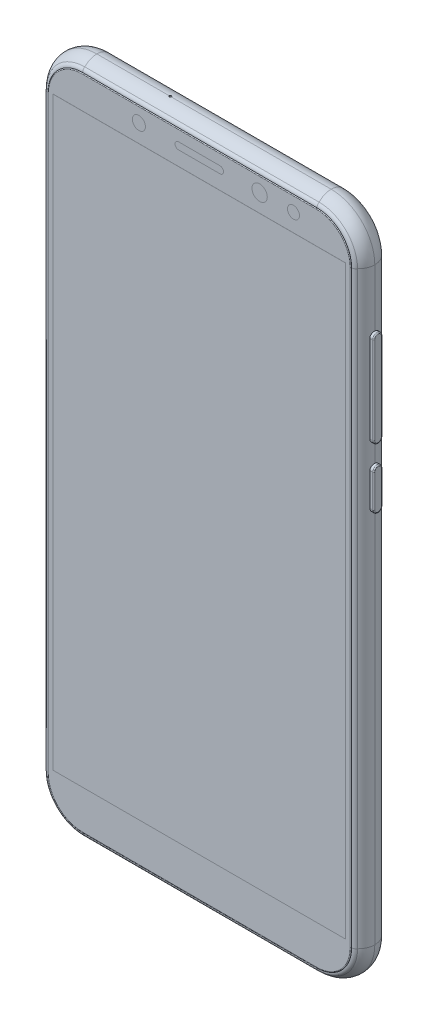
from build123d import *
from OCP.BRepFilletAPI import BRepFilletAPI_MakeChamfer

# Parameters (mm, degrees)
BOSS_EXTRUDE1_START       = -3.75
BOSS_EXTRUDE1_DEPTH       = 7.5
FILLET3_R                 = 3.75
FILLET4_R                 = 3.75
SKETCH7_W                 = 98.275097103
SKETCH7_H                 = 163.382348933
CUT_EXTRUDE3_DEPTH        = 1
BOSS_EXTRUDE4_DEPTH       = 0.5
FILLET6_R                 = 1
BOSS_EXTRUDE5_DEPTH       = 0.125
FILLET7_R                 = 0.25
CUT_EXTRUDE5_OUTLINE_R    = 1.375
CUT_EXTRUDE5_OUTLINE_R_2  = 1.75
CUT_EXTRUDE5_OUTLINE_R_3  = 1.5
CUT_EXTRUDE5_DEPTH        = 3.375
BOSS_EXTRUDE6_OUTLINE_R   = 1.375
BOSS_EXTRUDE6_OUTLINE_R_2 = 1.75
BOSS_EXTRUDE6_OUTLINE_R_3 = 1.5
BOSS_EXTRUDE6_DEPTH       = 3.375
BOSS_EXTRUDE7_DEPTH       = 3.375
SKETCH11_W                = 67.037317966
SKETCH11_H                = 134.07463593
CUT_EXTRUDE6_DEPTH        = 0.5
SKETCH11_2_W              = 67.037317966
SKETCH11_2_H              = 134.07463593
BOSS_EXTRUDE8_DEPTH       = 0.5
BOSS_EXTRUDE9_DEPTH       = 0.75
CHAMFER1_SIZE             = 0.375
SKETCH13_R                = 5.5
CUT_EXTRUDE7_DEPTH        = 0.5
CHAMFER2_SIZE             = 0.5
SKETCH14_R                = 1.5
CUT_EXTRUDE8_DEPTH        = 0.5
SKETCH14_3_R              = 1.5
BOSS_EXTRUDE10_DEPTH      = 0.5
SKETCH15_R                = 0.25
CUT_EXTRUDE9_DEPTH        = 1
SKETCH16_R                = 1.75
CUT_EXTRUDE11_DEPTH       = 15
CUT_EXTRUDE11_TAPER       = 1
SKETCH16_4_R              = 1
SKETCH16_4_R_2            = 0.5
CUT_EXTRUDE13_DEPTH       = 2
SKETCH17_W                = 13.25
SKETCH17_H                = 2
BOSS_EXTRUDE11_DEPTH      = 0.75
SKETCH18_W                = 67.087317966
SKETCH18_H                = 134.12463593
SKETCH18_W_2              = 67.037317966
SKETCH18_H_2              = 134.07463593
BOSS_EXTRUDE13_DEPTH      = 0.25
SKETCH20_R                = 1
BOSS_EXTRUDE15_DEPTH      = 0.3
CUT_EXTRUDE14_DEPTH       = 5
BOSS_EXTRUDE16_DEPTH      = 5.75
BOSS_EXTRUDE16_2_DEPTH    = 5.75
FILLET8_R                 = 0.25
FILLET9_R                 = 0.25
SKETCH26_R                = 2.5
SKETCH26_R_2              = 1.75
CUT_EXTRUDE16_DEPTH       = 0.75
SKETCH28_R                = 1.5
SKETCH28_R_2              = 0.875
CUT_EXTRUDE17_DEPTH       = 0.25
CHAMFER3_SIZE             = 0.5
CHAMFER3_SIZE_2           = 1.07225346
CHAMFER4_SIZE             = 0.3
CHAMFER4_SIZE_2           = 0.824243226
SKETCH26_2_R              = 2.5
SKETCH26_2_R_2            = 1.75
BOSS_EXTRUDE19_DEPTH      = 0.1
CHAMFER5_SIZE             = 0.3
CHAMFER5_SIZE2            = 0.824243226
CUT_EXTRUDE18_DEPTH       = 5
BOSS_EXTRUDE20_DEPTH      = 3
WRAP1_OUTLINE_W           = 0.664556962
WRAP1_OUTLINE_H           = 2.5
WRAP1_DEPTH               = 0.01


# Read off the part's stored shape, not the designer's step: Boss-Extrude1, Cut-Extrude5, Boss-Extrude6, Boss-Extrude7, Wrap1
# Some blends are built 0.0001 mm under size
with BuildPart() as part:
    # Boss-Extrude1 outline → Boss-Extrude1 (new body)
    with BuildSketch(Plane.XY.offset(BOSS_EXTRUDE1_START)):
        with BuildLine():
            ThreePointArc((36.825, 66.65), (33.896067812, 73.721067812), (26.825, 76.65))
            Line((26.825, 76.65), (-26.825, 76.65))
            ThreePointArc((-26.825, 76.65), (-33.896067812, 73.721067812), (-36.825, 66.65))
            Line((-36.825, 66.65), (-36.825, -68.2))
            ThreePointArc((-36.825, -68.2), (-33.896067812, -75.271067812), (-26.825, -78.2))
            Line((-26.825, -78.2), (26.825, -78.2))
            ThreePointArc((26.825, -78.2), (33.896067812, -75.271067812), (36.825, -68.2))
            Line((36.825, -68.2), (36.825, 66.65))
        make_face()
    extrude(amount=BOSS_EXTRUDE1_DEPTH)

    # Fillet3
    fillet3_edges = [part.edges().sort_by_distance(p)[0] for p in [
        (33.896067812, -75.271067812, -3.75),
        (36.825, -0.775, -3.75),
        (33.896067812, 73.721067812, -3.75),
        (0, 76.65, -3.75),
        (-33.896067812, 73.721067812, -3.75),
        (-36.825, -0.775, -3.75),
        (-33.896067812, -75.271067812, -3.75),
        (0, -78.2, -3.75),
    ]]
    fillet(fillet3_edges, radius=FILLET3_R)

    # Fillet4
    fillet4_edges = [part.edges().sort_by_distance(p)[0] for p in [
        (33.896067812, 73.721067812, 3.75),
        (36.825, -0.775, 3.75),
        (33.896067812, -75.271067812, 3.75),
        (0, -78.2, 3.75),
        (-33.896067812, -75.271067812, 3.75),
        (-36.825, -0.775, 3.75),
        (-33.896067812, 73.721067812, 3.75),
        (0, 76.65, 3.75),
    ]]
    fillet(fillet4_edges, radius=FILLET4_R - 0.0001)  # a hair under: the kernel refuses the full size

    # Sketch7 → Cut-Extrude3 (cut)
    with BuildSketch(Plane.XY.offset(3.75)):
        with Locations((-0.573991347, -2.324377783)):
            Rectangle(SKETCH7_W, SKETCH7_H)
    extrude(amount=-CUT_EXTRUDE3_DEPTH, mode=Mode.SUBTRACT)


with BuildPart() as body_2:
    # Sketch8 → Boss-Extrude4 (new body)
    with BuildSketch(Plane.XY.offset(2.75)):
        with BuildLine():
            Line((-26.825, -76.999509757), (26.825, -76.999509757))
            ThreePointArc((26.825, -76.999509757), (33.04719302, -74.42219302), (35.624509757, -68.2))
            Line((35.624509757, -68.2), (35.624509757, 66.65))
            ThreePointArc((35.624509757, 66.65), (33.04719302, 72.87219302), (26.825, 75.449509757))
            Line((26.825, 75.449509757), (-26.825, 75.449509757))
            ThreePointArc((-26.825, 75.449509757), (-33.04719302, 72.87219302), (-35.624509757, 66.65))
            Line((-35.624509757, 66.65), (-35.624509757, -68.2))
            ThreePointArc((-35.624509757, -68.2), (-33.04719302, -74.42219302), (-26.825, -76.999509757))
        make_face()
    extrude(amount=BOSS_EXTRUDE4_DEPTH)

    # Fillet6
    # the kernel refuses this fillet: 1 mm, written as the material it takes off along each edge
    with BuildSketch(Plane(origin=(-35.624509757, 66.65, 3.25), x_dir=(0, 0, -1), z_dir=(0, -1, 0)), Plane(origin=(35.624509757, -68.2, 3.25), x_dir=(0, 0, -1), z_dir=(0, 1, 0))) as fillet6_piece_1:
        with BuildLine():
            CenterArc((1, 0.866025404), FILLET6_R, 180, 60)
            Line((0, 0.866025404), (-0.02, 0.866025404))
            Line((-0.02, 0.866025404), (-0.02, 0))
            Line((-0.02, 0), (0, -0.02))
            ThreePointArc((0, -0.02), (0.25, -0.02), (0.49, -0.017320508))
            Line((0.49, -0.017320508), (0.5, 0))
        make_face()
    extrude(amount=134.85, mode=Mode.SUBTRACT)
    with BuildSketch(Plane(origin=(-26.825, 66.65, 3.25), x_dir=(0, 1, 0), z_dir=(1, 0, 0))) as fillet6_piece_2:
        with BuildLine():
            CenterArc((7.933484353, -1), FILLET6_R, 30, 60)
            Line((7.933484353, 0), (7.933484353, 0.02))
            Line((7.933484353, 0.02), (8.799509757, 0.02))
            Line((8.799509757, 0.02), (8.819509757, 0))
            ThreePointArc((8.819509757, 0), (8.819509757, -0.25), (8.816830265, -0.49))
            Line((8.816830265, -0.49), (8.799509757, -0.5))
        make_face()
    revolve(axis=Axis((-26.825, 66.65, 3.25), (0, 0, 1)), revolution_arc=90, mode=Mode.SUBTRACT)
    with BuildSketch(Plane(origin=(26.825, 75.449509757, 3.25), x_dir=(0, 0, -1), z_dir=(-1, 0, 0)), Plane(origin=(-26.825, -76.999509757, 3.25), x_dir=(0, 0, -1), z_dir=(1, 0, 0))) as fillet6_piece_3:
        with BuildLine():
            CenterArc((1, 0.866025404), FILLET6_R, 180, 60)
            Line((0, 0.866025404), (-0.02, 0.866025404))
            Line((-0.02, 0.866025404), (-0.02, 0))
            Line((-0.02, 0), (0, -0.02))
            ThreePointArc((0, -0.02), (0.25, -0.02), (0.49, -0.017320508))
            Line((0.49, -0.017320508), (0.5, 0))
        make_face()
    extrude(amount=53.65, mode=Mode.SUBTRACT)
    with BuildSketch(Plane(origin=(26.825, 66.65, 3.25), x_dir=(1, 0, 0), z_dir=(0, -1, 0))) as fillet6_piece_4:
        with BuildLine():
            CenterArc((7.933484353, -1), FILLET6_R, 30, 60)
            Line((7.933484353, 0), (7.933484353, 0.02))
            Line((7.933484353, 0.02), (8.799509757, 0.02))
            Line((8.799509757, 0.02), (8.819509757, 0))
            ThreePointArc((8.819509757, 0), (8.819509757, -0.25), (8.816830265, -0.49))
            Line((8.816830265, -0.49), (8.799509757, -0.5))
        make_face()
    revolve(axis=Axis((26.825, 66.65, 3.25), (0, 0, 1)), revolution_arc=90, mode=Mode.SUBTRACT)
    with BuildSketch(Plane(origin=(26.825, -68.2, 3.25), x_dir=(0, -1, 0), z_dir=(-1, 0, 0))) as fillet6_piece_5:
        with BuildLine():
            CenterArc((7.933484353, -1), FILLET6_R, 30, 60)
            Line((7.933484353, 0), (7.933484353, 0.02))
            Line((7.933484353, 0.02), (8.799509757, 0.02))
            Line((8.799509757, 0.02), (8.819509757, 0))
            ThreePointArc((8.819509757, 0), (8.819509757, -0.25), (8.816830265, -0.49))
            Line((8.816830265, -0.49), (8.799509757, -0.5))
        make_face()
    revolve(axis=Axis((26.825, -68.2, 3.25), (0, 0, 1)), revolution_arc=90, mode=Mode.SUBTRACT)
    with BuildSketch(Plane(origin=(-26.825, -68.2, 3.25), x_dir=(-1, 0, 0), z_dir=(0, 1, 0))) as fillet6_piece_6:
        with BuildLine():
            CenterArc((7.933484353, -1), FILLET6_R, 30, 60)
            Line((7.933484353, 0), (7.933484353, 0.02))
            Line((7.933484353, 0.02), (8.799509757, 0.02))
            Line((8.799509757, 0.02), (8.819509757, 0))
            ThreePointArc((8.819509757, 0), (8.819509757, -0.25), (8.816830265, -0.49))
            Line((8.816830265, -0.49), (8.799509757, -0.5))
        make_face()
    revolve(axis=Axis((-26.825, -68.2, 3.25), (0, 0, 1)), revolution_arc=90, mode=Mode.SUBTRACT)


with BuildPart() as body_3:
    # Sketch9 → Boss-Extrude5 (new body)
    with BuildSketch(Plane.XY.offset(3.25)):
        with BuildLine():
            Line((-34.758484353, 66.65), (-34.758484353, -68.2))
            ThreePointArc((-34.758484353, -68.2), (-32.434820584, -73.809820584), (-26.825, -76.133484353))
            Line((-26.825, -76.133484353), (26.825, -76.133484353))
            ThreePointArc((26.825, -76.133484353), (32.434820584, -73.809820584), (34.758484353, -68.2))
            Line((34.758484353, -68.2), (34.758484353, 66.65))
            ThreePointArc((34.758484353, 66.65), (32.434820584, 72.259820584), (26.825, 74.583484353))
            Line((26.825, 74.583484353), (-26.825, 74.583484353))
            ThreePointArc((-26.825, 74.583484353), (-32.434820584, 72.259820584), (-34.758484353, 66.65))
        make_face()
    extrude(amount=BOSS_EXTRUDE5_DEPTH)

    # Fillet7
    # the kernel refuses this fillet: 0.25 mm, written as the material it takes off along each edge
    with BuildSketch(Plane(origin=(26.825, 74.583484353, 3.375), x_dir=(0, 0, -1), z_dir=(-1, 0, 0)), Plane(origin=(-26.825, -76.133484353, 3.375), x_dir=(0, 0, -1), z_dir=(1, 0, 0))) as fillet7_piece_1:
        with BuildLine():
            CenterArc((0.25, 0.216506351), FILLET7_R, 180, 60)
            Line((0, 0.216506351), (-0.005, 0.216506351))
            Line((-0.005, 0.216506351), (-0.005, 0))
            Line((-0.005, 0), (0, -0.005))
            ThreePointArc((0, -0.005), (0.0625, -0.005), (0.1225, -0.004330127))
            Line((0.1225, -0.004330127), (0.125, 0))
        make_face()
    extrude(amount=53.65, mode=Mode.SUBTRACT)
    with BuildSketch(Plane(origin=(26.825, 66.65, 3.375), x_dir=(1, 0, 0), z_dir=(0, -1, 0))) as fillet7_piece_2:
        with BuildLine():
            CenterArc((7.716978002, -0.25), FILLET7_R, 30, 60)
            Line((7.716978002, 0), (7.716978002, 0.005))
            Line((7.716978002, 0.005), (7.933484353, 0.005))
            Line((7.933484353, 0.005), (7.938484353, 0))
            ThreePointArc((7.938484353, 0), (7.938484353, -0.0625), (7.93781448, -0.1225))
            Line((7.93781448, -0.1225), (7.933484353, -0.125))
        make_face()
    revolve(axis=Axis((26.825, 66.65, 3.375), (0, 0, 1)), revolution_arc=90, mode=Mode.SUBTRACT)
    with BuildSketch(Plane(origin=(34.758484353, -68.2, 3.375), x_dir=(0, 0, -1), z_dir=(0, 1, 0)), Plane(origin=(-34.758484353, 66.65, 3.375), x_dir=(0, 0, -1), z_dir=(0, -1, 0))) as fillet7_piece_3:
        with BuildLine():
            CenterArc((0.25, 0.216506351), FILLET7_R, 180, 60)
            Line((0, 0.216506351), (-0.005, 0.216506351))
            Line((-0.005, 0.216506351), (-0.005, 0))
            Line((-0.005, 0), (0, -0.005))
            ThreePointArc((0, -0.005), (0.0625, -0.005), (0.1225, -0.004330127))
            Line((0.1225, -0.004330127), (0.125, 0))
        make_face()
    extrude(amount=134.85, mode=Mode.SUBTRACT)
    with BuildSketch(Plane(origin=(26.825, -68.2, 3.375), x_dir=(0, -1, 0), z_dir=(-1, 0, 0))) as fillet7_piece_4:
        with BuildLine():
            CenterArc((7.716978002, -0.25), FILLET7_R, 30, 60)
            Line((7.716978002, 0), (7.716978002, 0.005))
            Line((7.716978002, 0.005), (7.933484353, 0.005))
            Line((7.933484353, 0.005), (7.938484353, 0))
            ThreePointArc((7.938484353, 0), (7.938484353, -0.0625), (7.93781448, -0.1225))
            Line((7.93781448, -0.1225), (7.933484353, -0.125))
        make_face()
    revolve(axis=Axis((26.825, -68.2, 3.375), (0, 0, 1)), revolution_arc=90, mode=Mode.SUBTRACT)
    with BuildSketch(Plane(origin=(-26.825, -68.2, 3.375), x_dir=(-1, 0, 0), z_dir=(0, 1, 0))) as fillet7_piece_5:
        with BuildLine():
            CenterArc((7.716978002, -0.25), FILLET7_R, 30, 60)
            Line((7.716978002, 0), (7.716978002, 0.005))
            Line((7.716978002, 0.005), (7.933484353, 0.005))
            Line((7.933484353, 0.005), (7.938484353, 0))
            ThreePointArc((7.938484353, 0), (7.938484353, -0.0625), (7.93781448, -0.1225))
            Line((7.93781448, -0.1225), (7.933484353, -0.125))
        make_face()
    revolve(axis=Axis((-26.825, -68.2, 3.375), (0, 0, 1)), revolution_arc=90, mode=Mode.SUBTRACT)
    with BuildSketch(Plane(origin=(-26.825, 66.65, 3.375), x_dir=(0, 1, 0), z_dir=(1, 0, 0))) as fillet7_piece_6:
        with BuildLine():
            CenterArc((7.716978002, -0.25), FILLET7_R, 30, 60)
            Line((7.716978002, 0), (7.716978002, 0.005))
            Line((7.716978002, 0.005), (7.933484353, 0.005))
            Line((7.933484353, 0.005), (7.938484353, 0))
            ThreePointArc((7.938484353, 0), (7.938484353, -0.0625), (7.93781448, -0.1225))
            Line((7.93781448, -0.1225), (7.933484353, -0.125))
        make_face()
    revolve(axis=Axis((-26.825, 66.65, 3.375), (0, 0, 1)), revolution_arc=90, mode=Mode.SUBTRACT)


with BuildPart() as cut_extrude5_tool:
    # Cut-Extrude5 outline → Cut-Extrude5 (new body)
    with BuildSketch(Plane.XY):
        with Locations((21.575, 71.15)):
            Circle(CUT_EXTRUDE5_OUTLINE_R)
        with Locations((13.825, 71.15)):
            Circle(CUT_EXTRUDE5_OUTLINE_R_2)
        with BuildLine():
            ThreePointArc((4.75, 70.35), (5.55, 71.15), (4.75, 71.95))
            Line((4.75, 71.95), (-4.75, 71.95))
            ThreePointArc((-4.75, 71.95), (-5.55, 71.15), (-4.75, 70.35))
            Line((-4.75, 70.35), (4.75, 70.35))
        make_face()
        with Locations((-13.825, 71.15)):
            Circle(CUT_EXTRUDE5_OUTLINE_R_3)
    extrude(amount=CUT_EXTRUDE5_DEPTH)


with BuildPart() as part_1:
    add(part.part)

    # Cut-Extrude5: cut by cut_extrude5_tool
    add(cut_extrude5_tool.part, mode=Mode.SUBTRACT)

    # Sketch13 → Cut-Extrude7 (cut)
    with BuildSketch(Plane(origin=(0, 0, -3.75), x_dir=(-1, 0, 0), z_dir=(0, 0, -1))):
        with Locations((0, 39.25)):
            Circle(SKETCH13_R)
    extrude(amount=-CUT_EXTRUDE7_DEPTH, mode=Mode.SUBTRACT)

    # Chamfer2
    chamfer2_edges = [part_1.edges().sort_by_distance(p)[0] for p in [
        (5.5, 39.25, -3.25),
    ]]
    chamfer(chamfer2_edges, length=CHAMFER2_SIZE - 0.0001)  # a hair under: the kernel refuses the full size

    # Sketch14 → Cut-Extrude8 (cut)
    with BuildSketch(Plane(origin=(0, 0, -3.75), x_dir=(-1, 0, 0), z_dir=(0, 0, -1))):
        with Locations((0, 69.75)):
            Circle(SKETCH14_R)
    extrude(amount=-CUT_EXTRUDE8_DEPTH, mode=Mode.SUBTRACT)

    # Sketch15 → Cut-Extrude9 (cut)
    with BuildSketch(Plane(origin=(0, 76.65, 0), x_dir=(1, 0, 0), z_dir=(0, 1, 0))):
        with Locations(Location((-10, 0, 0), (0, 0, 270))):
            Circle(SKETCH15_R)
    extrude(amount=-CUT_EXTRUDE9_DEPTH, mode=Mode.SUBTRACT)

    # Sketch16 → Cut-Extrude11 (cut)
    with BuildSketch(Plane(origin=(0, -78.2, 0), x_dir=(1, 0, 0), z_dir=(0, 1, 0))):
        with Locations((-23.5, 1.5)):
            Circle(SKETCH16_R)
    extrude(amount=CUT_EXTRUDE11_DEPTH, taper=CUT_EXTRUDE11_TAPER, mode=Mode.SUBTRACT)

    # Sketch16<4> → Cut-Extrude13 (cut)
    with BuildSketch(Plane(origin=(0, -78.2, 0), x_dir=(1, 0, 0), z_dir=(0, 1, 0))):
        with Locations(Location((13.75, 1, 0), (0, 0, 270))):
            Circle(SKETCH16_4_R)
        with Locations(Location((16, 1, 0), (0, 0, 270))):
            Circle(SKETCH16_4_R)
        with Locations(Location((18.25, 1, 0), (0, 0, 270))):
            Circle(SKETCH16_4_R)
        with Locations(Location((20.5, 1, 0), (0, 0, 270))):
            Circle(SKETCH16_4_R)
        with Locations(Location((22.75, 1, 0), (0, 0, 270))):
            Circle(SKETCH16_4_R)
        with Locations(Location((25, 1, 0), (0, 0, 270))):
            Circle(SKETCH16_4_R)
        with Locations(Location((-16, 0.25, 0), (0, 0, 330))):
            Circle(SKETCH16_4_R_2)
    extrude(amount=CUT_EXTRUDE13_DEPTH, mode=Mode.SUBTRACT)

    # Sketch21 → Cut-Extrude14 (cut)
    with BuildSketch(Plane(origin=(36.825, 0, 0), x_dir=(0, 0, -1), z_dir=(1, 0, 0))):
        with BuildLine():
            Line((1, 52.525), (1, 32.525))
            ThreePointArc((1, 32.525), (0, 31.525), (-1, 32.525))
            Line((-1, 32.525), (-1, 52.525))
            ThreePointArc((-1, 52.525), (0, 53.525), (1, 52.525))
        make_face()
        with BuildLine():
            Line((1, 26.275), (1, 18.775))
            ThreePointArc((1, 18.775), (0, 17.775), (-1, 18.775))
            Line((-1, 18.775), (-1, 26.275))
            ThreePointArc((-1, 26.275), (0, 27.275), (1, 26.275))
        make_face()
    extrude(amount=-CUT_EXTRUDE14_DEPTH, mode=Mode.SUBTRACT)

    # Sketch28 → Cut-Extrude17 (cut)
    with BuildSketch(Plane(origin=(0, 0, -3.75), x_dir=(-1, 0, 0), z_dir=(0, 0, -1))):
        with Locations((0, 61.275)):
            Circle(SKETCH28_R)
        with Locations((0, 52.525)):
            Circle(SKETCH28_R_2)
    extrude(amount=-CUT_EXTRUDE17_DEPTH, mode=Mode.SUBTRACT)

    # Chamfer3
    # the kernel refuses this chamfer: 1.07225346, 0.5 mm, written as the material it adds along each edge
    with BuildSketch(Plane(origin=(0, 61.275, -3.5), x_dir=(-1, 0, 0), z_dir=(0, -1, 0))) as chamfer3_piece_1_section:
        Polygon((1.5, CHAMFER3_SIZE), (1.5 - CHAMFER3_SIZE_2, 0), (1.5, 0), align=None)
    chamfer3_piece_1 = revolve(axis=Axis((0, 61.275, -3.5), (0, 0, -1)), mode=Mode.PRIVATE)
    chamfer3_piece_1 = split(chamfer3_piece_1, bisect_by=Plane(origin=(0.681277572, 61.275, -3.75), z_dir=(0, 0, 1)), keep=Keep.TOP, mode=Mode.PRIVATE)
    add(chamfer3_piece_1)

    # Chamfer4
    # the kernel refuses this chamfer: 0.824243226, 0.3 mm, written as the material it adds along each edge
    with BuildSketch(Plane(origin=(0, 52.525, -3.5), x_dir=(-1, 0, 0), z_dir=(0, -1, 0))) as chamfer4_piece_1_section:
        Polygon((0.875, CHAMFER4_SIZE), (0.875 - CHAMFER4_SIZE_2, 0), (0.875, 0), align=None)
    chamfer4_piece_1 = revolve(axis=Axis((0, 52.525, -3.5), (0, 0, -1)), mode=Mode.PRIVATE)
    chamfer4_piece_1 = split(chamfer4_piece_1, bisect_by=Plane(origin=(0.381438827, 52.525, -3.75), z_dir=(0, 0, 1)), keep=Keep.TOP, mode=Mode.PRIVATE)
    add(chamfer4_piece_1)

    # Sketch29 → Cut-Extrude18 (cut)
    with BuildSketch(Plane(origin=(0, -78.2, 0), x_dir=(1, 0, 0), z_dir=(0, 1, 0))):
        with BuildLine():
            Line((-3, 1.75), (3, 1.75))
            Line((3, 1.75), (4, 1.83816349))
            Line((4, 1.83816349), (4.5, 1.75))
            Line((4.5, 1.75), (4.5, 0.374264069))
            ThreePointArc((4.5, 0.374264069), (4.47716386, 0.259459039), (4.412132034, 0.162132034))
            Line((4.412132034, 0.162132034), (4.087867966, -0.162132034))
            ThreePointArc((4.087867966, -0.162132034), (3.990540961, -0.22716386), (3.875735931, -0.25))
            Line((3.875735931, -0.25), (-3.875735931, -0.25))
            ThreePointArc((-3.875735931, -0.25), (-3.990540961, -0.22716386), (-4.087867966, -0.162132034))
            Line((-4.087867966, -0.162132034), (-4.412132034, 0.162132034))
            ThreePointArc((-4.412132034, 0.162132034), (-4.47716386, 0.259459039), (-4.5, 0.374264069))
            Line((-4.5, 0.374264069), (-4.5, 1.75))
            Line((-4.5, 1.75), (-4, 1.83816349))
            Line((-4, 1.83816349), (-3, 1.75))
        make_face()
    extrude(amount=CUT_EXTRUDE18_DEPTH, mode=Mode.SUBTRACT)

    # Sketch30 → Boss-Extrude20 (add)
    with BuildSketch(Plane.XZ.offset(73.2)):
        Polygon((1.25, -1.4), (1.75, -1.4), (1.75, -1.35), (2.75, -1.35), (2.75, -1.4), (2.75, -1.55), (-2.75, -1.55), (-2.75, -1.4), (-2.75, -1.35), (-1.75, -1.35), (-1.75, -1.4), (-1.25, -1.4), (-1.25, -1.35), (-0.25, -1.35), (-0.25, -1.4), (0.25, -1.4), (0.25, -1.35), (1.25, -1.35), align=None)
    extrude(amount=BOSS_EXTRUDE20_DEPTH)


with BuildPart() as body_2_1:
    add(body_2.part)

    # Cut-Extrude5: cut by cut_extrude5_tool
    add(cut_extrude5_tool.part, mode=Mode.SUBTRACT)


with BuildPart() as body_3_1:
    add(body_3.part)

    # Cut-Extrude5: cut by cut_extrude5_tool
    add(cut_extrude5_tool.part, mode=Mode.SUBTRACT)


with BuildPart() as body_4:
    # Boss-Extrude6 outline → Boss-Extrude6 (new body)
    with BuildSketch(Plane.XY):
        with Locations((21.575, 71.15)):
            Circle(BOSS_EXTRUDE6_OUTLINE_R)
        with Locations((13.825, 71.15)):
            Circle(BOSS_EXTRUDE6_OUTLINE_R_2)
        with Locations((-13.825, 71.15)):
            Circle(BOSS_EXTRUDE6_OUTLINE_R_3)
    extrude(amount=BOSS_EXTRUDE6_DEPTH)


with BuildPart() as body_5:
    # Boss-Extrude7 outline → Boss-Extrude7 (new body)
    with BuildSketch(Plane.XY):
        with BuildLine():
            Line((-4.75, 70.35), (4.75, 70.35))
            ThreePointArc((4.75, 70.35), (5.55, 71.15), (4.75, 71.95))
            Line((4.75, 71.95), (-4.75, 71.95))
            ThreePointArc((-4.75, 71.95), (-5.55, 71.15), (-4.75, 70.35))
        make_face()
    extrude(amount=BOSS_EXTRUDE7_DEPTH)


with BuildPart() as cut_extrude6_tool:
    # Sketch11 → Cut-Extrude6 (new body)
    with BuildSketch(Plane.XY.offset(3.375)):
        Rectangle(SKETCH11_W, SKETCH11_H)
    extrude(amount=-CUT_EXTRUDE6_DEPTH)


with BuildPart() as body_2_2:
    add(body_2_1.part)

    # Cut-Extrude6: cut by cut_extrude6_tool
    add(cut_extrude6_tool.part, mode=Mode.SUBTRACT)

    # Wrap1 outline → Wrap1 (add)
    # profile 1 of 6: a face of its own
    with BuildSketch(Plane.XY.offset(3.25)):
        with BuildLine():
            add(Edge.make_bspline(
                [(-4.272151899, -72.605497802), (-4.272103151, -72.629901637), (-4.272009862, -72.676602742), (-4.267466785, -72.743173199), (-4.262816767, -72.803370143), (-4.254087951, -72.856600114), (-4.244459561, -72.903524471), (-4.23064322, -72.943127736), (-4.216536835, -72.976985589), (-4.198120437, -73.004290978), (-4.175699439, -73.026387544), (-4.149116235, -73.045451421), (-4.117230762, -73.060928411), (-4.080743792, -73.07382795), (-4.039453801, -73.08357735), (-3.993278043, -73.090170191), (-3.942273322, -73.094800417), (-3.906591215, -73.095266329), (-3.887954905, -73.095509669)],
                knots=[0, 0, 0, 0, 0.098463136, 0.188426829, 0.269251677, 0.341981202, 0.406054352, 0.462222047, 0.511056507, 0.553678021, 0.594131488, 0.637514529, 0.685114564, 0.73666458, 0.793459079, 0.856022604, 0.924802442, 1, 1, 1, 1], degree=3))
            Line((-4.272151899, -72.605497802), (-4.272151899, -71.133484353))
            Line((-4.272151899, -71.133484353), (-4.936708861, -71.133484353))
            Line((-4.936708861, -71.133484353), (-4.936708861, -72.657910777))
            add(Edge.make_bspline(
                [(-4.751285601, -73.414932138), (-4.767301136, -73.395196677), (-4.799545495, -73.355462923), (-4.838553785, -73.288773383), (-4.871281602, -73.217340974), (-4.891774528, -73.153228228), (-4.904715486, -73.097365713), (-4.913762015, -73.050082324), (-4.920287166, -72.997355537), (-4.926231996, -72.939492391), (-4.931201751, -72.87635647), (-4.934554961, -72.808093716), (-4.936563604, -72.734729643), (-4.936659304, -72.684118631), (-4.936708861, -72.657910777)],
                knots=[0, 0, 0, 0, 0.095471978, 0.192215427, 0.289588384, 0.390547671, 0.444677731, 0.50522475, 0.571504321, 0.644412587, 0.724001007, 0.809656588, 0.901434644, 1, 1, 1, 1], degree=3))
            add(Edge.make_bspline(
                [(-3.990803006, -73.665129923), (-4.014868385, -73.664901523), (-4.06185799, -73.664455554), (-4.130463312, -73.66211289), (-4.195276506, -73.657690253), (-4.256162338, -73.651403756), (-4.313176919, -73.642807485), (-4.366566969, -73.633264218), (-4.416000368, -73.62123429), (-4.476318652, -73.604014477), (-4.545613018, -73.574961102), (-4.62258891, -73.532193823), (-4.691876497, -73.478707626), (-4.731401586, -73.436277566), (-4.751285601, -73.414932138)],
                knots=[0, 0, 0, 0, 0.087182691, 0.17023128, 0.248633885, 0.32248448, 0.391895532, 0.457477181, 0.518881284, 0.57612994, 0.68457129, 0.790181218, 0.894445786, 1, 1, 1, 1], degree=3))
            Line((-3.990803006, -73.665129923), (-3.66445807, -73.665129923))
            add(Edge.make_bspline(
                [(-2.901997627, -73.414932138), (-2.92202898, -73.436305935), (-2.961947456, -73.478899632), (-3.032152415, -73.532043643), (-3.109637268, -73.57500343), (-3.179303117, -73.603939204), (-3.239751378, -73.621247082), (-3.289036901, -73.633196479), (-3.342237361, -73.642868976), (-3.399100813, -73.651392768), (-3.459983962, -73.657693474), (-3.524797942, -73.662111953), (-3.593403038, -73.664455808), (-3.640392675, -73.664901609), (-3.66445807, -73.665129923)],
                knots=[0, 0, 0, 0, 0.105778007, 0.210794381, 0.316728416, 0.425520862, 0.482663705, 0.543954313, 0.608828818, 0.678111576, 0.751825671, 0.830083362, 0.912978451, 1, 1, 1, 1], degree=3))
            add(Edge.make_bspline(
                [(-2.721518987, -72.657910777), (-2.721571896, -72.684612942), (-2.721674136, -72.73621242), (-2.72363723, -72.810896508), (-2.727098107, -72.879967346), (-2.731647479, -72.943587535), (-2.736550005, -73.001730938), (-2.74431019, -73.054429557), (-2.752427507, -73.10165428), (-2.76478619, -73.156848061), (-2.784713514, -73.220006148), (-2.81591771, -73.290547421), (-2.85450392, -73.356215561), (-2.886161289, -73.395353638), (-2.901997627, -73.414932138)],
                knots=[0, 0, 0, 0, 0.100588621, 0.194378255, 0.281413628, 0.361085759, 0.434670275, 0.501141981, 0.561676296, 0.615149931, 0.71412158, 0.810578019, 0.905243216, 1, 1, 1, 1], degree=3))
            Line((-2.721518987, -72.657910777), (-2.721518987, -71.133484353))
            Line((-2.721518987, -71.133484353), (-3.386075949, -71.133484353))
            Line((-3.386075949, -71.133484353), (-3.386075949, -72.605497802))
            add(Edge.make_bspline(
                [(-3.766811709, -73.095509669), (-3.748345654, -73.095197005), (-3.712852383, -73.094596038), (-3.662118898, -73.090849783), (-3.616292102, -73.084057264), (-3.57537131, -73.074233413), (-3.539333107, -73.061603113), (-3.507984328, -73.046156124), (-3.4815996, -73.028044101), (-3.4595718, -73.00626468), (-3.44175034, -72.979103818), (-3.426812299, -72.945843061), (-3.413938412, -72.905707309), (-3.404091086, -72.858759343), (-3.395576288, -72.80514864), (-3.389915506, -72.744709074), (-3.386455802, -72.677401296), (-3.386206582, -72.630225719), (-3.386075949, -72.605497802)],
                knots=[0, 0, 0, 0, 0.074708996, 0.143596808, 0.205649136, 0.261930043, 0.313602087, 0.359823778, 0.402924381, 0.442530604, 0.484327126, 0.533553448, 0.589644431, 0.654520179, 0.727421869, 0.80916471, 0.899970294, 1, 1, 1, 1], degree=3))
            Line((-3.766811709, -73.095509669), (-3.887954905, -73.095509669))
        make_face()
    # profile 2 of 6: a face of its own
    with BuildSketch(Plane.XY.offset(3.25)):
        Polygon((-6.307357595, -72.09719084), (-6.749901108, -71.133484353), (-7.5, -71.133484353), (-6.64556962, -72.757297644), (-6.64556962, -73.633484353), (-5.981012658, -73.633484353), (-5.981012658, -72.757297644), (-5.126582278, -71.133484353), (-5.873714399, -71.133484353), align=None)
    # profile 3 of 6: a face of its own
    with BuildSketch(Plane.XY.offset(3.25)):
        Polygon((-0.697685918, -71.133484353), (-1.722211234, -71.133484353), (-2.436708861, -73.633484353), (-1.722211234, -73.633484353), (-1.60897943, -73.190446378), (-0.826246044, -73.190446378), (-0.714497627, -73.633484353), (0, -73.633484353), align=None)
        Polygon((-1.190170095, -71.650691631), (-0.942939082, -72.684117264), (-1.48684731, -72.684117264), (-1.233188291, -71.650691631), align=None, mode=Mode.SUBTRACT)
    # profile 4 of 6: a face of its own
    with BuildSketch(Plane.XY.offset(3.25)):
        Polygon((2.196400316, -71.133484353), (1.45272943, -71.133484353), (1.065565665, -73.049030239), (0.830696203, -71.133484353), (0.158227848, -71.133484353), (0.540446994, -73.633484353), (1.499208861, -73.633484353), (1.814675633, -71.937479606), (2.118275316, -73.633484353), (3.067147943, -73.633484353), (3.481012658, -71.133484353), (2.812005538, -71.133484353), (2.551918513, -73.049030239), align=None)
    # profile 5 of 6: a face of its own
    with BuildSketch(Plane.XY.offset(3.25)):
        Polygon((5.732792722, -71.133484353), (3.860759494, -71.133484353), (3.860759494, -73.633484353), (5.759493671, -73.633484353), (5.759493671, -73.0638641), (4.525316456, -73.0638641), (4.525316456, -72.589180556), (5.697191456, -72.589180556), (5.697191456, -72.114497011), (4.525316456, -72.114497011), (4.525316456, -71.703104606), (5.732792722, -71.703104606), align=None)
    # profile 6 of 6: a face of its own
    with BuildSketch(Plane.XY.offset(3.25)):
        with Locations((6.534810127, -72.383484353)):
            Rectangle(WRAP1_OUTLINE_W, WRAP1_OUTLINE_H)
    extrude(amount=WRAP1_DEPTH)


with BuildPart() as body_3_2:
    add(body_3_1.part)

    # Cut-Extrude6: cut by cut_extrude6_tool
    add(cut_extrude6_tool.part, mode=Mode.SUBTRACT)


with BuildPart() as body_6:
    # Sketch11<2> → Boss-Extrude8 (new body)
    with BuildSketch(Plane.XY.offset(3.375)):
        Rectangle(SKETCH11_2_W, SKETCH11_2_H)
    extrude(amount=-BOSS_EXTRUDE8_DEPTH)


with BuildPart() as body_7:
    # Sketch12 → Boss-Extrude9 (new body)
    with BuildSketch(Plane(origin=(0, 0, -3.75), x_dir=(-1, 0, 0), z_dir=(0, 0, -1))):
        with BuildLine():
            Line((5, 61.275), (5, 52.525))
            ThreePointArc((5, 52.525), (0, 47.525), (-5, 52.525))
            Line((-5, 52.525), (-5, 61.275))
            ThreePointArc((-5, 61.275), (0, 66.275), (5, 61.275))
        make_face()
    extrude(amount=BOSS_EXTRUDE9_DEPTH)

    # Chamfer1
    chamfer1_edges = [body_7.edges().sort_by_distance(p)[0] for p in [
        (0, 47.525, -4.5),
        (-5, 56.9, -4.5),
        (0, 66.275, -4.5),
        (5, 56.9, -4.5),
    ]]
    chamfer(chamfer1_edges, length=CHAMFER1_SIZE)

    # Sketch26 → Cut-Extrude16 (cut)
    with BuildSketch(Plane(origin=(0, 0, -4.5), x_dir=(-1, 0, 0), z_dir=(0, 0, -1))):
        with Locations((0, 61.275)):
            Circle(SKETCH26_R)
        with Locations((0, 52.525)):
            Circle(SKETCH26_R_2)
    extrude(amount=-CUT_EXTRUDE16_DEPTH, mode=Mode.SUBTRACT)

    # Sketch26<2> → Boss-Extrude19 (add)
    with BuildSketch(Plane(origin=(0, 0, -4.5), x_dir=(-1, 0, 0), z_dir=(0, 0, -1))):
        with Locations((0, 61.275)):
            Circle(SKETCH26_2_R)
        with Locations((0, 52.525)):
            Circle(SKETCH26_2_R_2)
    extrude(amount=-BOSS_EXTRUDE19_DEPTH)

    # Chamfer5: one chamfer whose edges measure the first distance from different faces: ONE call of the kernel's chamfer builder (chamfer() names one face for all edges)
    chamfer5_edges_1 = [body_7.edges().sort_by_distance(p)[0] for p in [
        (2.5, 61.275, -3.75),
    ]]
    chamfer5_side_1 = [body_7.faces().sort_by_distance(p)[0] for p in [
        (2.5, 61.275, -4.075),
    ]]
    chamfer5_edges_2 = [body_7.edges().sort_by_distance(p)[0] for p in [
        (1.75, 52.525, -3.75),
    ]]
    chamfer5_side_2 = [body_7.faces().sort_by_distance(p)[0] for p in [
        (1.75, 52.525, -4.075),
    ]]
    chamfer5 = BRepFilletAPI_MakeChamfer(body_7.part.solid().wrapped)
    for e in chamfer5_edges_1:
        chamfer5.Add(CHAMFER5_SIZE, CHAMFER5_SIZE2, e.wrapped, chamfer5_side_1[0].wrapped)  # the first distance lies on this face
    for e in chamfer5_edges_2:
        chamfer5.Add(CHAMFER5_SIZE, CHAMFER5_SIZE2, e.wrapped, chamfer5_side_2[0].wrapped)  # the first distance lies on this face
    add(Compound.cast(chamfer5.Shape()), mode=Mode.REPLACE)


with BuildPart() as body_8:
    # Sketch14<3> → Boss-Extrude10 (new body)
    with BuildSketch(Plane(origin=(0, 0, -3.75), x_dir=(-1, 0, 0), z_dir=(0, 0, -1))):
        with Locations((0, 69.75)):
            Circle(SKETCH14_3_R)
    extrude(amount=-BOSS_EXTRUDE10_DEPTH)


with BuildPart() as body_9:
    # Sketch17 → Boss-Extrude11 (new body)
    with BuildSketch(Plane(origin=(0, -76.2, 0), x_dir=(1, 0, 0), z_dir=(0, 1, 0))):
        with Locations((19.375, 1)):
            Rectangle(SKETCH17_W, SKETCH17_H)
    extrude(amount=-BOSS_EXTRUDE11_DEPTH)


with BuildPart() as body_10:
    # Sketch18 → Boss-Extrude13 (new body)
    with BuildSketch(Plane.XY.offset(3.375)):
        Rectangle(SKETCH18_W, SKETCH18_H)
        Rectangle(SKETCH18_W_2, SKETCH18_H_2, mode=Mode.SUBTRACT)
    extrude(amount=-BOSS_EXTRUDE13_DEPTH)


with BuildPart() as body_11:
    # Sketch20 → Boss-Extrude15 (new body)
    with BuildSketch(Plane.XY.offset(-3.25)):
        with Locations((0, 69.75)):
            Circle(SKETCH20_R)
    extrude(amount=-BOSS_EXTRUDE15_DEPTH)


with BuildPart() as body_12:
    # Sketch23 → Boss-Extrude16 (new body)
    with BuildSketch(Plane(origin=(31.825, 0, 0), x_dir=(0, 0, -1), z_dir=(1, 0, 0))):
        with BuildLine():
            Line((-1, 26.275), (-1, 18.775))
            ThreePointArc((-1, 18.775), (0, 17.775), (1, 18.775))
            Line((1, 18.775), (1, 26.275))
            ThreePointArc((1, 26.275), (0, 27.275), (-1, 26.275))
        make_face()
    extrude(amount=BOSS_EXTRUDE16_DEPTH)

    # Fillet9
    fillet9_edges = [body_12.edges().sort_by_distance(p)[0] for p in [
        (37.575, 17.775, 0),
        (37.575, 22.525, -1),
        (37.575, 27.275, 0),
        (37.575, 22.525, 1),
    ]]
    fillet(fillet9_edges, radius=FILLET9_R)


with BuildPart() as body_13:
    # Sketch23 → Boss-Extrude16 2 (new body)
    with BuildSketch(Plane(origin=(31.825, 0, 0), x_dir=(0, 0, -1), z_dir=(1, 0, 0))):
        with BuildLine():
            Line((-1, 52.525), (-1, 32.525))
            ThreePointArc((-1, 32.525), (0, 31.525), (1, 32.525))
            Line((1, 32.525), (1, 52.525))
            ThreePointArc((1, 52.525), (0, 53.525), (-1, 52.525))
        make_face()
    extrude(amount=BOSS_EXTRUDE16_2_DEPTH)

    # Fillet8
    fillet8_edges = [body_13.edges().sort_by_distance(p)[0] for p in [
        (37.575, 31.525, 0),
        (37.575, 42.525, -1),
        (37.575, 53.525, 0),
        (37.575, 42.525, 1),
    ]]
    fillet(fillet8_edges, radius=FILLET8_R)


solid = Compound([part_1.part, body_4.part, body_5.part, body_2_2.part, body_3_2.part, body_6.part, body_7.part, body_8.part, body_9.part, body_10.part, body_11.part, body_12.part, body_13.part])
